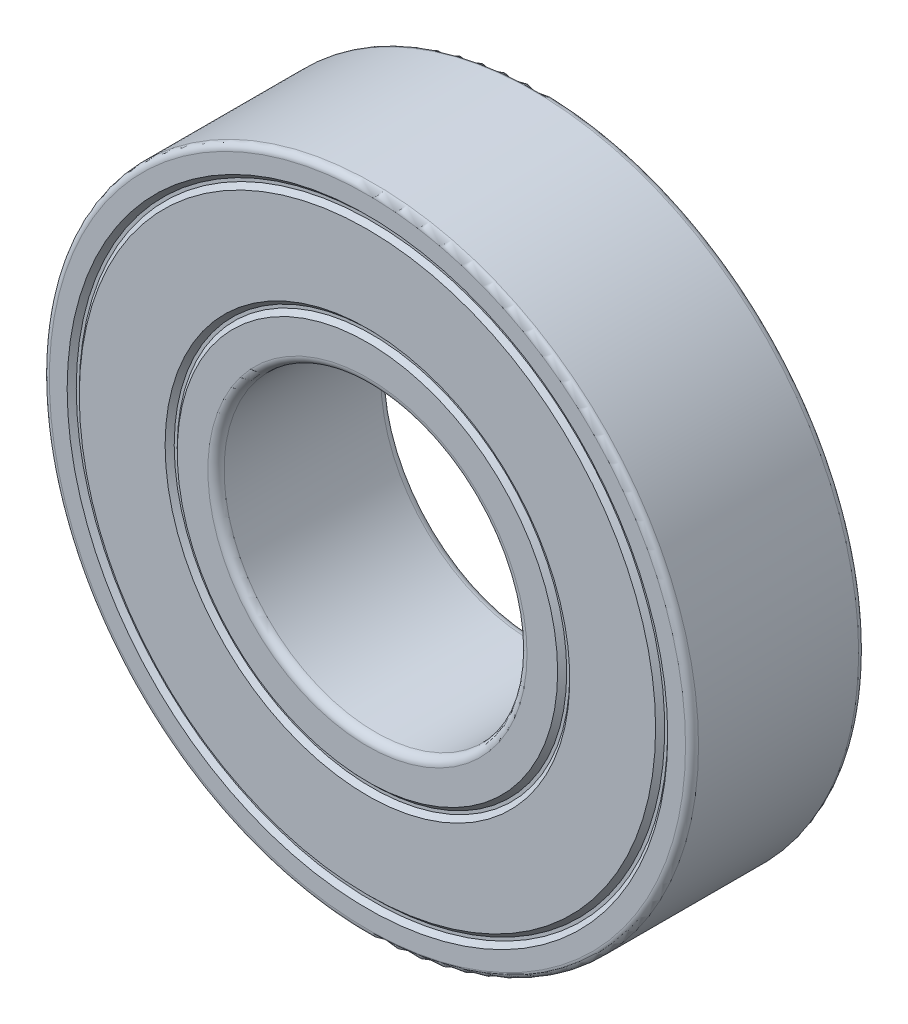
from build123d import *

# Parameters (mm, degrees)
SKETCH3_W         = 12.7
SKETCH3_H         = 2.116666667
SKETCH3_H_2       = 3.175
SKETCH4_R         = 4.445
CIRPATTERN1_COUNT = 7
FILLET1_R         = 0.47625
FILLET2_R         = 0.5953125
CHAMFER1_SIZE     = 0.333375
CHAMFER2_SIZE     = 0.333375


# Read off the part's stored shape, not the designer's step: Thicken1
with BuildPart() as part:
    # Sketch3 → Revolve1 (revolve)
    with BuildSketch(Plane(origin=(0, 0, 0), x_dir=(0, 0, -1), z_dir=(1, 0, 0)), mode=Mode.PRIVATE) as revolve1_sk:
        with Locations((0, -22.754166667)):
            Rectangle(SKETCH3_W, SKETCH3_H)
        with Locations((0, -12.7)):
            Rectangle(SKETCH3_W, SKETCH3_H_2)
    revolve(revolve1_sk.sketch.rotate(Axis((0, 0, 6.35), (0, 0, -1)), 270), axis=Axis((0, 0, 6.35), (0, 0, -1)))

    # Sketch4 → Cut-Revolve1 (revolve, cut)
    with BuildSketch(Plane(origin=(0, 0, 0), x_dir=(0, 0, -1), z_dir=(1, 0, 0)), mode=Mode.PRIVATE) as cut_revolve1_sk:
        with Locations((0, -17.991666667)):
            Circle(SKETCH4_R)
    revolve(cut_revolve1_sk.sketch.rotate(Axis((0, 0, 6.35), (0, 0, -1)), 270), axis=Axis((0, 0, 6.35), (0, 0, -1)), mode=Mode.SUBTRACT)

    # Fillet1
    fillet1_edges = [part.edges().sort_by_distance(p)[0] for p in [
        (-23.8125, 0, -6.35),
        (-23.8125, 0, 6.35),
    ]]
    fillet(fillet1_edges, radius=FILLET1_R)

    # Fillet2
    fillet2_edges = [part.edges().sort_by_distance(p)[0] for p in [
        (-11.1125, 0, -6.35),
        (-11.1125, 0, 6.35),
    ]]
    fillet(fillet2_edges, radius=FILLET2_R)

    # Chamfer1
    chamfer1_edges = [part.edges().sort_by_distance(p)[0] for p in [
        (-21.695833333, 0, 6.35),
        (-21.695833333, 0, -6.35),
    ]]
    chamfer(chamfer1_edges, length=CHAMFER1_SIZE)

    # Chamfer2
    chamfer2_edges = [part.edges().sort_by_distance(p)[0] for p in [
        (-14.2875, 0, 6.35),
        (-14.2875, 0, -6.35),
    ]]
    chamfer(chamfer2_edges, length=CHAMFER2_SIZE)


with BuildPart() as body_2:
    # Sketch5 → Revolve2 (revolve)
    with BuildSketch(Plane(origin=(0, 0, 0), x_dir=(0, 0, -1), z_dir=(1, 0, 0))):
        with BuildLine():
            Line((0, -13.546666667), (0, -22.436666667))
            ThreePointArc((0, -22.436666667), (4.445, -17.991666667), (0, -13.546666667))
        make_face()
    revolve(axis=Axis((0, -13.546666667, 0), (0, -1, 0)))


with BuildPart() as cirpattern1_1:
    # CirPattern1: pattern copy
    add(body_2.part.rotate(Axis((0, 0, 0), (0, 0, 1)), 1 * 360 / CIRPATTERN1_COUNT))


with BuildPart() as cirpattern1_2:
    # CirPattern1: pattern copy
    add(body_2.part.rotate(Axis((0, 0, 0), (0, 0, 1)), 2 * 360 / CIRPATTERN1_COUNT))


with BuildPart() as cirpattern1_3:
    # CirPattern1: pattern copy
    add(body_2.part.rotate(Axis((0, 0, 0), (0, 0, 1)), 3 * 360 / CIRPATTERN1_COUNT))


with BuildPart() as cirpattern1_4:
    # CirPattern1: pattern copy
    add(body_2.part.rotate(Axis((0, 0, 0), (0, 0, 1)), 4 * 360 / CIRPATTERN1_COUNT))


with BuildPart() as cirpattern1_5:
    # CirPattern1: pattern copy
    add(body_2.part.rotate(Axis((0, 0, 0), (0, 0, 1)), 5 * 360 / CIRPATTERN1_COUNT))


with BuildPart() as cirpattern1_6:
    # CirPattern1: pattern copy
    add(body_2.part.rotate(Axis((0, 0, 0), (0, 0, 1)), 6 * 360 / CIRPATTERN1_COUNT))


with BuildPart() as body_9:
    # Thicken1 outline → Thicken1 (revolve)
    with BuildSketch(Plane.XZ):
        Polygon((14.2875, 6.016625), (14.2875, 5.889625), (14.562355122, 5.889625), (14.895730122, 6.223), (21.087603211, 6.223), (21.420978211, 5.889625), (21.695833333, 5.889625), (21.695833333, 6.016625), (21.473583333, 6.016625), (21.140208333, 6.35), (14.843125, 6.35), (14.50975, 6.016625), align=None)
    revolve(axis=Axis((0, 0, 0), (0, 0, 1)))


with BuildPart() as body_10:
    # Mirror1: mirrored copy
    add(body_9.part.mirror(Plane.XY))


solid = Compound([part.part, body_2.part, cirpattern1_1.part, cirpattern1_2.part, cirpattern1_3.part, cirpattern1_4.part, cirpattern1_5.part, cirpattern1_6.part, body_9.part, body_10.part])
